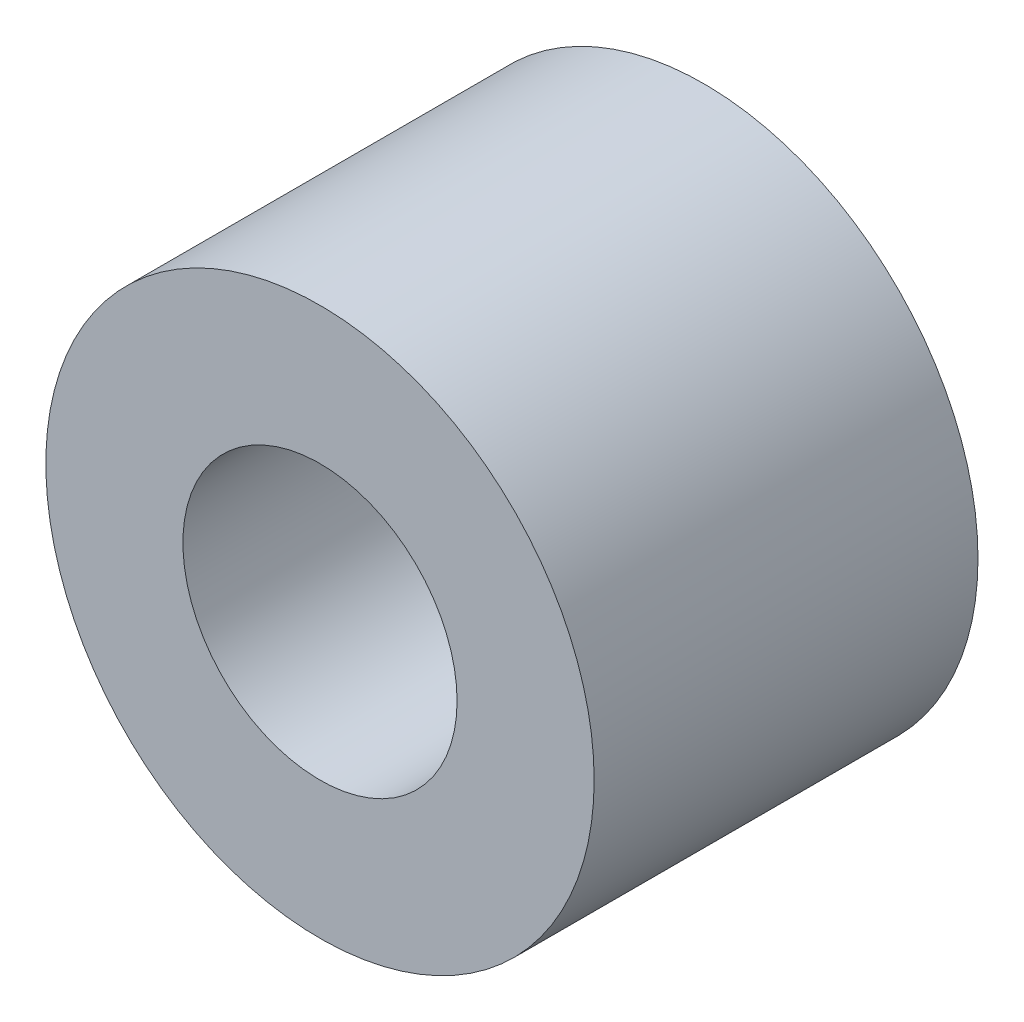
from build123d import *

# Parameters (mm, degrees)
CROQUIS1_R              = 5
CROQUIS1_R_2            = 2.5
SALIENTE_EXTRUIR1_DEPTH = 7


with BuildPart() as part:
    # Croquis1 → Saliente-Extruir1 (new body)
    with BuildSketch(Plane.XY):
        with Locations((45.5, 14.8)):
            Circle(CROQUIS1_R)
        with Locations((45.5, 14.8)):
            Circle(CROQUIS1_R_2, mode=Mode.SUBTRACT)
    extrude(amount=SALIENTE_EXTRUIR1_DEPTH)


solid = part.part
